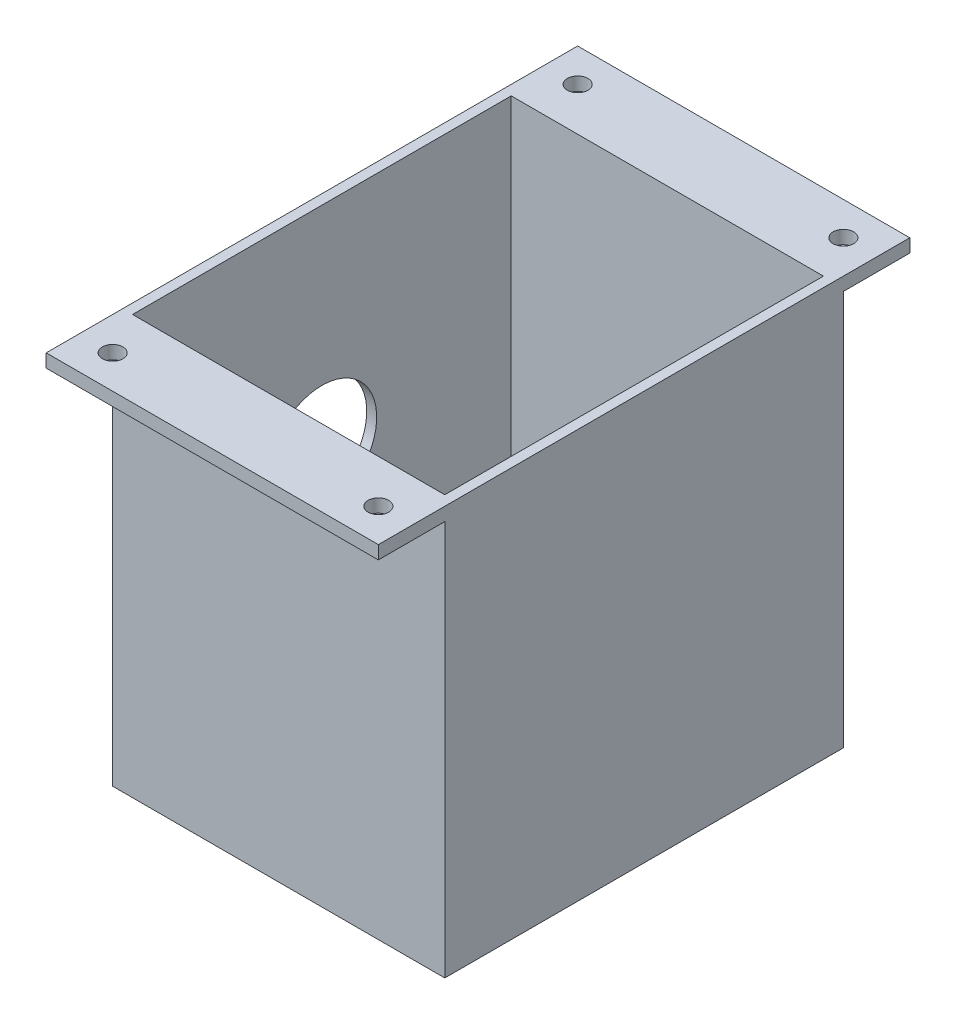
from build123d import *

# Parameters (mm, degrees)
SKETCH1_W           = 50
SKETCH1_H           = 60
SKETCH1_W_2         = 47
SKETCH1_H_2         = 57
BOSS_EXTRUDE6_DEPTH = 60
SKETCH7_W           = 50
SKETCH7_H           = 60
BOSS_EXTRUDE8_DEPTH = 1.5
SKETCH8_W           = 10
SKETCH8_H           = 2
BOSS_EXTRUDE9_DEPTH = 50
SKETCH9_R           = 1.55
CUT_EXTRUDE1_DEPTH  = 3
SKETCH11_R          = 8.25
CUT_EXTRUDE3_DEPTH  = 1.5


with BuildPart() as part:
    # Sketch1 → Boss-Extrude6 (new body)
    with BuildSketch(Plane(origin=(0, 0, 0), x_dir=(1, 0, 0), z_dir=(0, 1, 0))):
        Rectangle(SKETCH1_W, SKETCH1_H)
        Rectangle(SKETCH1_W_2, SKETCH1_H_2, mode=Mode.SUBTRACT)
    extrude(amount=BOSS_EXTRUDE6_DEPTH)

    # Sketch7 → Boss-Extrude8 (add)
    with BuildSketch(Plane.XZ):
        Rectangle(SKETCH7_W, SKETCH7_H)
    extrude(amount=BOSS_EXTRUDE8_DEPTH)

    # Sketch8 → Boss-Extrude9 (add)
    with BuildSketch(Plane(origin=(25, 0, 0), x_dir=(0, 0, -1), z_dir=(1, 0, 0))):
        with Locations((-35, 59)):
            Rectangle(SKETCH8_W, SKETCH8_H)
        with Locations((35, 59)):
            Rectangle(SKETCH8_W, SKETCH8_H)
    extrude(amount=-BOSS_EXTRUDE9_DEPTH)

    # Sketch9 → Cut-Extrude1 (cut)
    with BuildSketch(Plane(origin=(0, 60, 0), x_dir=(1, 0, 0), z_dir=(0, 1, 0))):
        with Locations((-20, 35)):
            Circle(SKETCH9_R)
        with Locations((20, 35)):
            Circle(SKETCH9_R)
        with Locations((20, -35)):
            Circle(SKETCH9_R)
        with Locations((-20, -35)):
            Circle(SKETCH9_R)
    extrude(amount=-CUT_EXTRUDE1_DEPTH, mode=Mode.SUBTRACT)

    # Sketch11 → Cut-Extrude3 (cut)
    with BuildSketch(Plane.ZY.offset(25)):
        with Locations((0, 28.25)):
            Circle(SKETCH11_R)
    extrude(amount=-CUT_EXTRUDE3_DEPTH, mode=Mode.SUBTRACT)


solid = part.part
